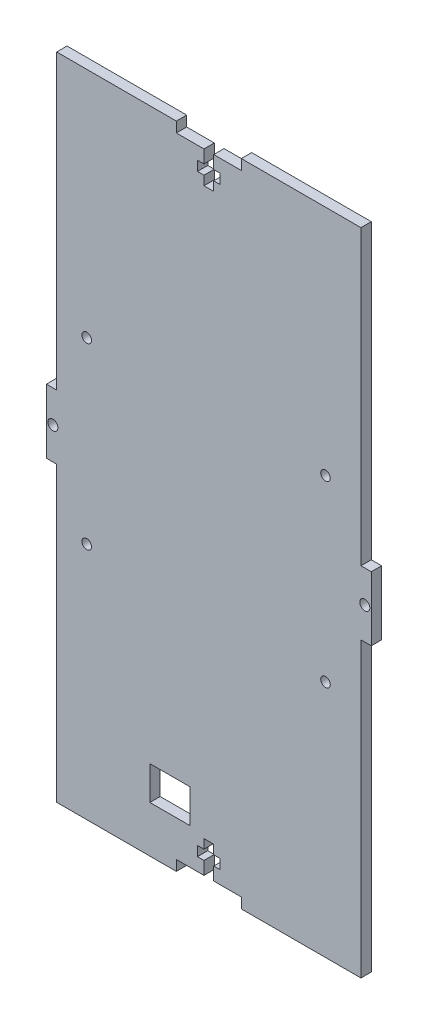
from build123d import *

# Parameters (mm, degrees)
SKETCH1_W           = 100
SKETCH1_H           = 200
BOSS_EXTRUDE2_DEPTH = 3.18
SKETCH2_R           = 1.55
SKETCH2_W           = 3.18
SKETCH2_H           = 90.125
CUT_EXTRUDE1_DEPTH  = 112.84861376
SKETCH4_W           = 12.353553391
SKETCH4_H           = 10.353553391
CUT_EXTRUDE3_DEPTH  = 112.84861376
SKETCH5_R           = 1.47
CUT_EXTRUDE4_DEPTH  = 112.84861376


with BuildPart() as part:
    # Sketch1 → Boss-Extrude2 (new body)
    with BuildSketch(Plane.XY):
        Rectangle(SKETCH1_W, SKETCH1_H)
    extrude(amount=BOSS_EXTRUDE2_DEPTH)

    # Sketch2 → Cut-Extrude1 (cut, through all)
    with BuildSketch(Plane.XY.offset(3.18)):
        with Locations((-48, 0)):
            Circle(SKETCH2_R)
        Polygon((-10, 100), (-10, 96.82), (-1.5, 96.82), (-1.5, 92.82), (-3.5, 92.82), (-3.5, 89.82), (-1.5, 89.82), (-1.5, 87), (1.5, 87), (1.5, 89.82), (3.5, 89.82), (3.5, 92.82), (1.5, 92.82), (1.5, 96.82), (10, 96.82), (10, 100), align=None)
        with Locations((-48.41, 54.9375)):
            Rectangle(SKETCH2_W, SKETCH2_H)
        with Locations((-48.41, -54.9375)):
            Rectangle(SKETCH2_W, SKETCH2_H)
    cut_extrude1 = extrude(amount=-CUT_EXTRUDE1_DEPTH, mode=Mode.SUBTRACT)

    # Mirror1: Cut-Extrude1 across plane
    add(cut_extrude1.mirror(Plane.ZX), mode=Mode.SUBTRACT)

    # Mirror3: Cut-Extrude1 across plane
    add(cut_extrude1.mirror(Plane(origin=(0, 0, 0), x_dir=(0, 0, 1), z_dir=(1, 0, 0))), mode=Mode.SUBTRACT)

    # Sketch4 → Cut-Extrude3 (cut, through all)
    with BuildSketch(Plane.XY.offset(3.18)):
        with Locations((-11.973223305, -80.523223305)):
            Rectangle(SKETCH4_W, SKETCH4_H)
    extrude(amount=-CUT_EXTRUDE3_DEPTH, mode=Mode.SUBTRACT)

    # Sketch5 → Cut-Extrude4 (cut, through all)
    with BuildSketch(Plane.XY.offset(3.18)):
        with Locations((-37.58090562, 28.464149283)):
            Circle(SKETCH5_R)
        with Locations((35.904481485, 28.464149283)):
            Circle(SKETCH5_R)
        with Locations((-37.58090562, -26.535850717)):
            Circle(SKETCH5_R)
        with Locations((35.904481485, -26.535850717)):
            Circle(SKETCH5_R)
    extrude(amount=-CUT_EXTRUDE4_DEPTH, mode=Mode.SUBTRACT)


solid = part.part
